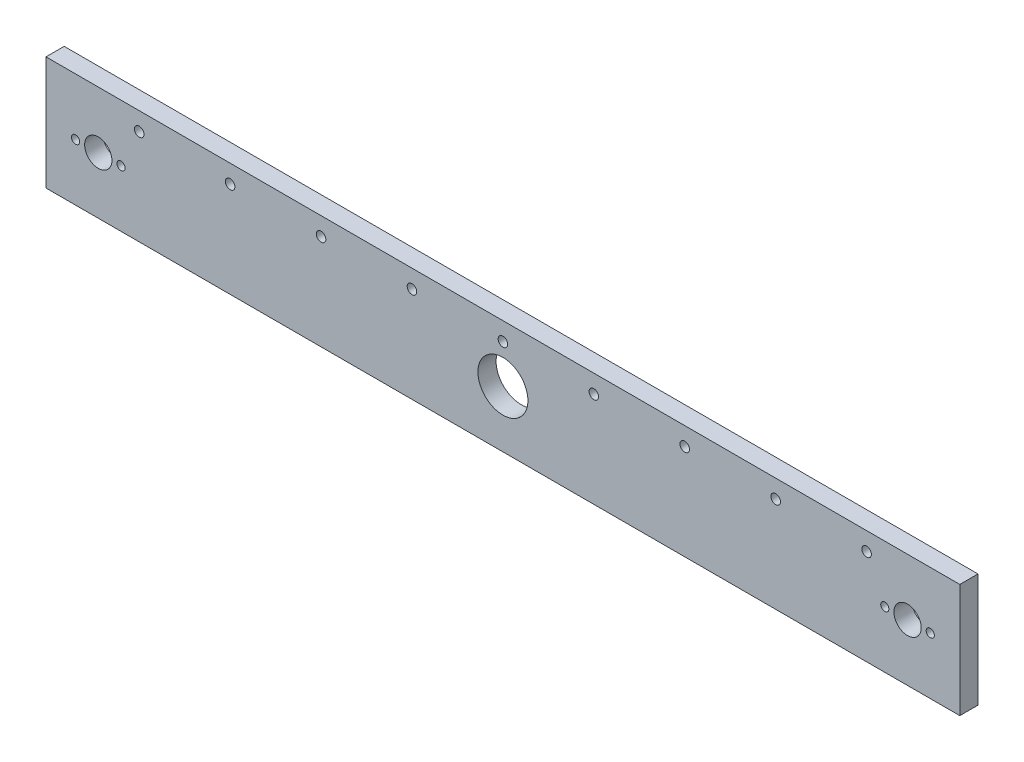
from build123d import *

# Parameters (mm, degrees)
SKETCH1_W           = 402
SKETCH1_H           = 50
SKETCH1_R           = 6
SKETCH1_R_2         = 1.8
SKETCH1_R_3         = 11
SKETCH1_R_4         = 2.1
BOSS_EXTRUDE1_DEPTH = 8


with BuildPart() as part:
    # Sketch1 → Boss-Extrude1 (new body)
    with BuildSketch(Plane.XY):
        Rectangle(SKETCH1_W, SKETCH1_H)
        with Locations((-178, 0)):
            Circle(SKETCH1_R, mode=Mode.SUBTRACT)
        with Locations((168, 0)):
            Circle(SKETCH1_R_2, mode=Mode.SUBTRACT)
        Circle(SKETCH1_R_3, mode=Mode.SUBTRACT)
        with Locations((-188, 0)):
            Circle(SKETCH1_R_2, mode=Mode.SUBTRACT)
        with Locations((-168, 0)):
            Circle(SKETCH1_R_2, mode=Mode.SUBTRACT)
        with Locations((188, 0)):
            Circle(SKETCH1_R_2, mode=Mode.SUBTRACT)
        with Locations((178, 0)):
            Circle(SKETCH1_R, mode=Mode.SUBTRACT)
        with Locations((0, 17)):
            Circle(SKETCH1_R_4, mode=Mode.SUBTRACT)
        with Locations((-40, 17)):
            Circle(SKETCH1_R_4, mode=Mode.SUBTRACT)
        with Locations((-80, 17)):
            Circle(SKETCH1_R_4, mode=Mode.SUBTRACT)
        with Locations((-120, 17)):
            Circle(SKETCH1_R_4, mode=Mode.SUBTRACT)
        with Locations((-160, 17)):
            Circle(SKETCH1_R_4, mode=Mode.SUBTRACT)
        with Locations((40, 17)):
            Circle(SKETCH1_R_4, mode=Mode.SUBTRACT)
        with Locations((80, 17)):
            Circle(SKETCH1_R_4, mode=Mode.SUBTRACT)
        with Locations((120, 17)):
            Circle(SKETCH1_R_4, mode=Mode.SUBTRACT)
        with Locations((160, 17)):
            Circle(SKETCH1_R_4, mode=Mode.SUBTRACT)
    extrude(amount=BOSS_EXTRUDE1_DEPTH)


solid = part.part
